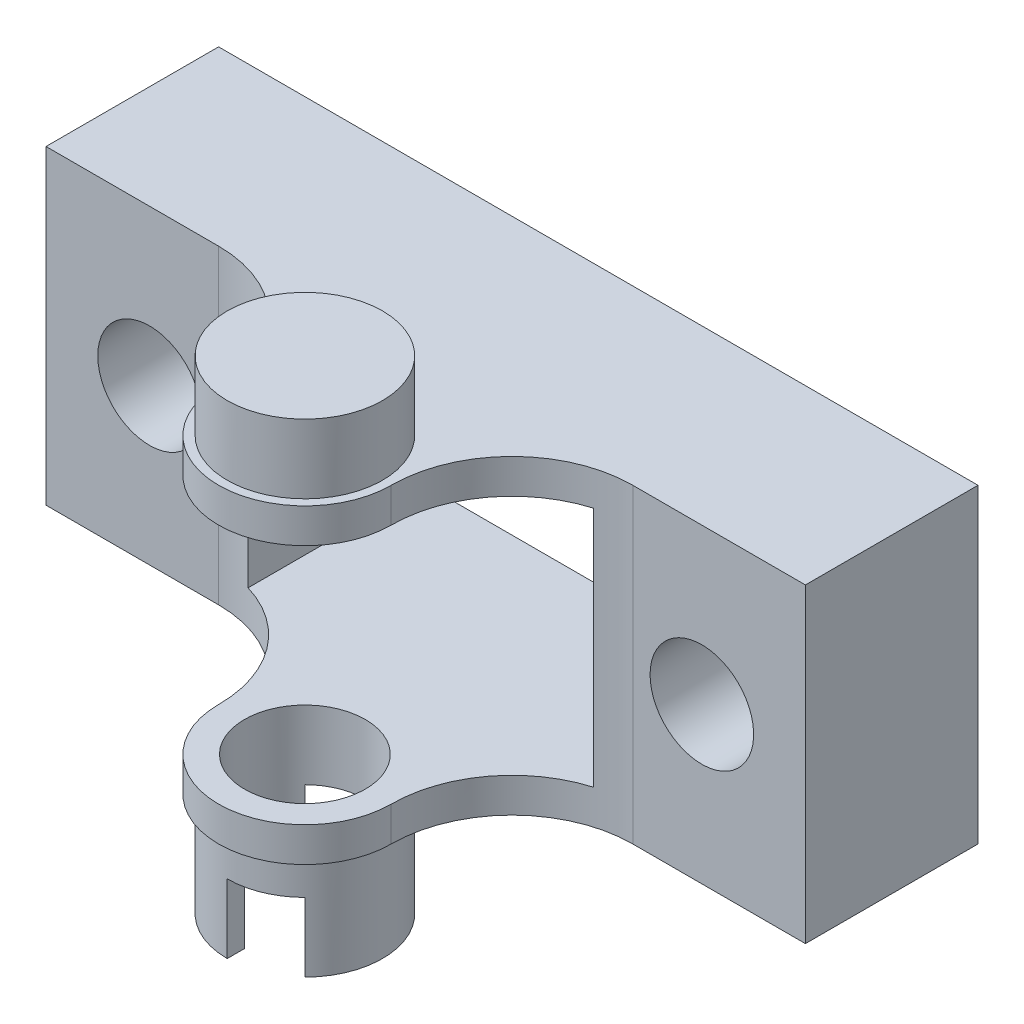
from build123d import *

# Parameters (mm, degrees)
SKETCH1_W            = 420
SKETCH1_H            = 350
BOSS_EXTRUDE1_DEPTH  = 10
FILLET2_R            = 5
SKETCH3_W            = 12
SKETCH3_H            = 9
BOSS_EXTRUDE2_DEPTH  = 7
SKETCH8_W            = 10
SKETCH8_H            = 7
CUT_EXTRUDE4_DEPTH   = 7
SKETCH7_R            = 1.75
CUT_EXTRUDE5_DEPTH   = 541.637586559
SKETCH9_R            = 2.25
BOSS_EXTRUDE3_DEPTH  = 3
CUT_EXTRUDE6_START   = -2
SKETCH11_R           = 1.75
CUT_EXTRUDE6_DEPTH   = 2
BOSS_EXTRUDE4_START  = 3
SKETCH12_R           = 2.25
BOSS_EXTRUDE4_DEPTH  = 3
CUT_EXTRUDE7_START   = -3
SKETCH13_R           = 1.75
CUT_EXTRUDE7_DEPTH   = 3
CUT_EXTRUDE8_START   = -2
CUT_EXTRUDE8_DEPTH   = 2
SKETCH17_R           = 1.75
BOSS_EXTRUDE5_DEPTH  = 1
CUT_EXTRUDE12_START  = -1
SKETCH21_R           = 2.25
CUT_EXTRUDE12_DEPTH  = 1
SKETCH22_R           = 1.75
BOSS_EXTRUDE7_DEPTH  = 1
SKETCH29_W           = 440
SKETCH29_H           = 370
BOSS_EXTRUDE11_DEPTH = 10
FILLET4_R            = 10
SKETCH30_W           = 540.70813329
SKETCH30_H           = 479.427878183
CUT_EXTRUDE13_DEPTH  = 10
SKETCH31_W           = 12
SKETCH31_H           = 9
SKETCH31_W_2         = 10
SKETCH31_H_2         = 7
BOSS_EXTRUDE12_DEPTH = 4
SKETCH32_W           = 5
SKETCH32_H           = 9
BOSS_EXTRUDE13_DEPTH = 5
SKETCH33_W           = 5
SKETCH33_H           = 9
BOSS_EXTRUDE14_DEPTH = 5
SKETCH34_R           = 1.5
CUT_EXTRUDE14_DEPTH  = 5


with BuildPart() as part:
    # Sketch1 → Boss-Extrude1 (new body)
    with BuildSketch(Plane.XY):
        with Locations((210, 175)):
            Rectangle(SKETCH1_W, SKETCH1_H)
    extrude(amount=BOSS_EXTRUDE1_DEPTH)

    # Fillet2
    fillet2_edges = [part.edges().sort_by_distance(p)[0] for p in [
        (420, 0, 5),
        (420, 350, 5),
        (0, 350, 5),
        (0, 0, 5),
    ]]
    fillet(fillet2_edges, radius=FILLET2_R)

    # Sketch3 → Boss-Extrude2 (add)
    with BuildSketch(Plane.XY.offset(10)):
        with Locations((36, 335.5)):
            Rectangle(SKETCH3_W, SKETCH3_H)
    extrude(amount=BOSS_EXTRUDE2_DEPTH)

    # Sketch8 → Cut-Extrude4 (cut)
    with BuildSketch(Plane.XY.offset(17)):
        with Locations((36, 335.5)):
            Rectangle(SKETCH8_W, SKETCH8_H)
    extrude(amount=-CUT_EXTRUDE4_DEPTH, mode=Mode.SUBTRACT)

    # Sketch7 → Cut-Extrude5 (cut, through all)
    with BuildSketch(Plane(origin=(0, 340, 0), x_dir=(1, 0, 0), z_dir=(0, 1, 0))):
        with BuildLine():
            Line((36, -17), (42, -17))
            Line((42, -17), (42, -11))
            ThreePointArc((42, -11), (39.525126266, -12.025126266), (38.5, -14.5))
            ThreePointArc((38.5, -14.5), (37.767766953, -16.267766953), (36, -17))
        make_face()
        with BuildLine():
            Line((30, -17), (36, -17))
            ThreePointArc((36, -17), (34.232233047, -16.267766953), (33.5, -14.5))
            ThreePointArc((33.5, -14.5), (32.474873734, -12.025126266), (30, -11))
            Line((30, -11), (30, -17))
        make_face()
        with Locations((36, -14.5)):
            Circle(SKETCH7_R)
    extrude(amount=-CUT_EXTRUDE5_DEPTH, mode=Mode.SUBTRACT)

    # Sketch9 → Boss-Extrude3 (add)
    with BuildSketch(Plane(origin=(0, 340, 0), x_dir=(1, 0, 0), z_dir=(0, 1, 0))):
        with Locations((36, -14.5)):
            Circle(SKETCH9_R)
    extrude(amount=BOSS_EXTRUDE3_DEPTH)

    # Sketch11 → Cut-Extrude6 (cut)
    with BuildSketch(Plane.XZ.offset(-340).offset(CUT_EXTRUDE6_START)):
        with Locations((36, 14.5)):
            Circle(SKETCH11_R)
    extrude(amount=CUT_EXTRUDE6_DEPTH, mode=Mode.SUBTRACT)

    # Sketch12 → Boss-Extrude4 (add)
    with BuildSketch(Plane.XZ.offset(-331).offset(BOSS_EXTRUDE4_START)):
        with Locations((36, 14.5)):
            Circle(SKETCH12_R)
    extrude(amount=-BOSS_EXTRUDE4_DEPTH)

    # Sketch13 → Cut-Extrude7 (cut)
    with BuildSketch(Plane.XZ.offset(-328).offset(CUT_EXTRUDE7_START)):
        with Locations((36, 14.5)):
            Circle(SKETCH13_R)
    extrude(amount=CUT_EXTRUDE7_DEPTH, mode=Mode.SUBTRACT)

    # Sketch14 → Cut-Extrude8 (cut)
    with BuildSketch(Plane.XZ.offset(-328).offset(CUT_EXTRUDE8_START)):
        with BuildLine():
            Line((36, 16.75), (36, 16.25))
            ThreePointArc((36, 16.25), (36.669696007, 16.116789182), (37.237436867, 15.737436867))
            Line((37.237436867, 15.737436867), (37.590990258, 16.090990258))
            ThreePointArc((37.590990258, 16.090990258), (36.861037723, 16.578728948), (36, 16.75))
        make_face()
        with BuildLine():
            Line((36, 12.25), (36, 12.75))
            ThreePointArc((36, 12.75), (35.330303993, 12.883210818), (34.762563133, 13.262563133))
            Line((34.762563133, 13.262563133), (34.409009742, 12.909009742))
            ThreePointArc((34.409009742, 12.909009742), (35.138962277, 12.421271052), (36, 12.25))
        make_face()
    extrude(amount=CUT_EXTRUDE8_DEPTH, mode=Mode.SUBTRACT)

    # Sketch17 → Boss-Extrude5 (add)
    with BuildSketch(Plane(origin=(0, 343, 0), x_dir=(1, 0, 0), z_dir=(0, 1, 0))):
        with Locations((36, -14.5)):
            Circle(SKETCH17_R)
    extrude(amount=-BOSS_EXTRUDE5_DEPTH)

    # Sketch21 → Cut-Extrude12 (cut)
    with BuildSketch(Plane(origin=(0, 343, 0), x_dir=(1, 0, 0), z_dir=(0, 1, 0)).offset(CUT_EXTRUDE12_START)):
        with Locations((36, -14.5)):
            Circle(SKETCH21_R)
    extrude(amount=CUT_EXTRUDE12_DEPTH, mode=Mode.SUBTRACT)

    # Sketch22 → Boss-Extrude7 (add)
    with BuildSketch(Plane(origin=(0, 342, 0), x_dir=(1, 0, 0), z_dir=(0, 1, 0))):
        with Locations((36, -14.5)):
            Circle(SKETCH22_R)
    extrude(amount=-BOSS_EXTRUDE7_DEPTH)

    # Sketch29 → Boss-Extrude11 (add)
    with BuildSketch(Plane(origin=(0, 0, 0), x_dir=(-1, 0, 0), z_dir=(0, 0, -1))):
        with Locations((-210, 175)):
            Rectangle(SKETCH29_W, SKETCH29_H)
    extrude(amount=-BOSS_EXTRUDE11_DEPTH)

    # Fillet4
    fillet4_edges = [part.edges().sort_by_distance(p)[0] for p in [
        (-10, 360, 5),
        (-10, -10, 5),
        (430, -10, 5),
        (430, 360, 5),
    ]]
    fillet(fillet4_edges, radius=FILLET4_R)

    # Sketch30 → Cut-Extrude13 (cut)
    with BuildSketch(Plane(origin=(0, 0, 0), x_dir=(-1, 0, 0), z_dir=(0, 0, -1))):
        with Locations((-198.735247223, 167.339968112)):
            Rectangle(SKETCH30_W, SKETCH30_H)
    extrude(amount=-CUT_EXTRUDE13_DEPTH, mode=Mode.SUBTRACT)

    # Sketch31 → Boss-Extrude12 (add)
    with BuildSketch(Plane(origin=(0, 0, 10), x_dir=(-1, 0, 0), z_dir=(0, 0, -1))):
        with Locations((-36, 335.5)):
            Rectangle(SKETCH31_W, SKETCH31_H)
        with Locations((-36, 335.5)):
            Rectangle(SKETCH31_W_2, SKETCH31_H_2, mode=Mode.SUBTRACT)
    extrude(amount=BOSS_EXTRUDE12_DEPTH)

    # Sketch32 → Boss-Extrude13 (add)
    with BuildSketch(Plane.ZY.offset(-30)):
        with Locations((8.5, 335.5)):
            Rectangle(SKETCH32_W, SKETCH32_H)
    extrude(amount=BOSS_EXTRUDE13_DEPTH)

    # Sketch33 → Boss-Extrude14 (add)
    with BuildSketch(Plane(origin=(42, 0, 0), x_dir=(0, 0, -1), z_dir=(1, 0, 0))):
        with Locations((-8.5, 335.5)):
            Rectangle(SKETCH33_W, SKETCH33_H)
    extrude(amount=BOSS_EXTRUDE14_DEPTH)

    # Sketch34 → Cut-Extrude14 (cut)
    with BuildSketch(Plane(origin=(0, 0, 6), x_dir=(-1, 0, 0), z_dir=(0, 0, -1))):
        with Locations((-28, 335.5)):
            Circle(SKETCH34_R)
        with Locations((-44, 335.5)):
            Circle(SKETCH34_R)
    extrude(amount=-CUT_EXTRUDE14_DEPTH, mode=Mode.SUBTRACT)


solid = part.part
